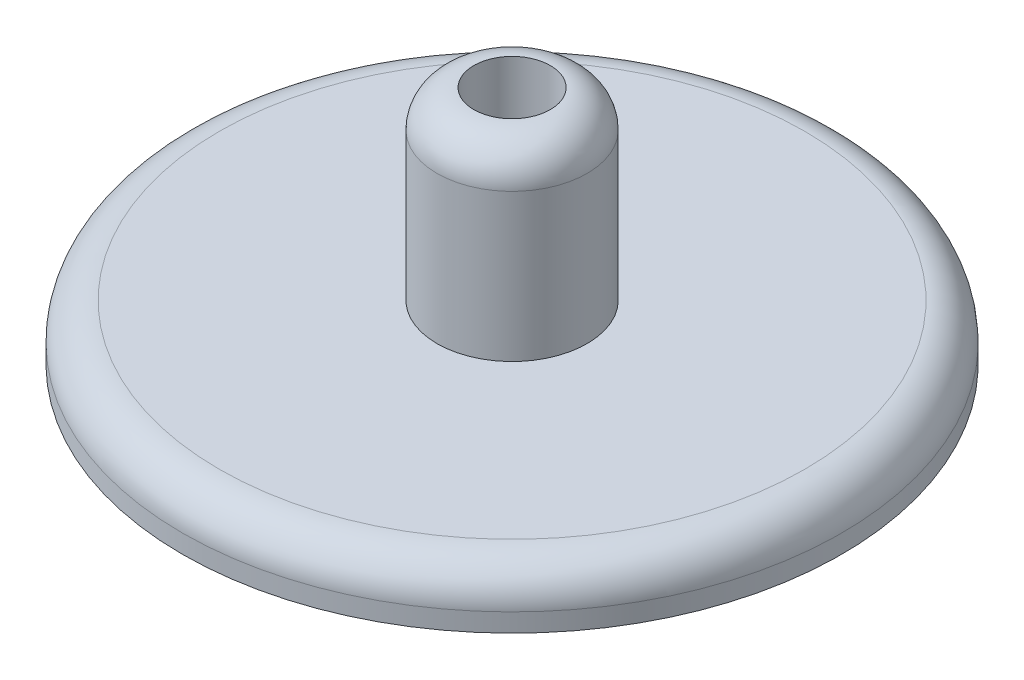
from build123d import *

# Parameters (mm, degrees)
SKETCH1_R           = 17.89
SKETCH1_R_2         = 4.075
SKETCH1_R_3         = 2.075
BOSS_EXTRUDE1_DEPTH = 3
BOSS_EXTRUDE2_START = 3
SKETCH1_4_R         = 4.075
SKETCH1_4_R_2       = 2.075
BOSS_EXTRUDE2_DEPTH = 5
BOSS_EXTRUDE3_START = 8
SKETCH1_5_R         = 4.075
SKETCH1_5_R_2       = 2.075
BOSS_EXTRUDE3_DEPTH = 5
FILLET1_R           = 2


with BuildPart() as part:
    # Sketch1 → Boss-Extrude1 (new body)
    # profile 1 of 3: a face of its own
    with BuildSketch(Plane(origin=(0, 0, 0), x_dir=(1, 0, 0), z_dir=(0, 1, 0))):
        with Locations(Location((-18.178896686, 33.907594253, 0), (0, 0, 270))):
            Circle(SKETCH1_R)
        with Locations((-18.178896686, 33.907594253)):
            Circle(SKETCH1_R_2, mode=Mode.SUBTRACT)
    # profile 2 of 3: a face of its own
    with BuildSketch(Plane(origin=(0, 0, 0), x_dir=(1, 0, 0), z_dir=(0, 1, 0))):
        with Locations((-18.178896686, 33.907594253)):
            Circle(SKETCH1_R_2)
        with Locations((-18.178896686, 33.907594253)):
            Circle(SKETCH1_R_3, mode=Mode.SUBTRACT)
    # profile 3 of 3: a face of its own
    with BuildSketch(Plane(origin=(0, 0, 0), x_dir=(1, 0, 0), z_dir=(0, 1, 0))):
        with Locations((-18.178896686, 33.907594253)):
            Circle(SKETCH1_R_3)
    extrude(amount=BOSS_EXTRUDE1_DEPTH)

    # Sketch1<4> → Boss-Extrude2 (add)
    # profile 1 of 2: a face of its own
    with BuildSketch(Plane(origin=(0, 0, 0), x_dir=(1, 0, 0), z_dir=(0, 1, 0)).offset(BOSS_EXTRUDE2_START)):
        with Locations(Location((-18.178896686, 33.907594253, 0), (0, 0, 270))):
            Circle(SKETCH1_4_R)
        with Locations((-18.178896686, 33.907594253)):
            Circle(SKETCH1_4_R_2, mode=Mode.SUBTRACT)
    # profile 2 of 2: a face of its own
    with BuildSketch(Plane(origin=(0, 0, 0), x_dir=(1, 0, 0), z_dir=(0, 1, 0)).offset(BOSS_EXTRUDE2_START)):
        with Locations((-18.178896686, 33.907594253)):
            Circle(SKETCH1_4_R_2)
    extrude(amount=BOSS_EXTRUDE2_DEPTH)

    # Sketch1<5> → Boss-Extrude3 (add)
    with BuildSketch(Plane(origin=(0, 0, 0), x_dir=(1, 0, 0), z_dir=(0, 1, 0)).offset(BOSS_EXTRUDE3_START)):
        with Locations(Location((-18.178896686, 33.907594253, 0), (0, 0, 270))):
            Circle(SKETCH1_5_R)
        with Locations(Location((-18.178896686, 33.907594253, 0), (0, 0, 270))):
            Circle(SKETCH1_5_R_2, mode=Mode.SUBTRACT)
    extrude(amount=BOSS_EXTRUDE3_DEPTH)

    # Fillet1
    fillet1_edges = [part.edges().sort_by_distance(p)[0] for p in [
        (-18.178896686, 13, -37.982594253),
        (-18.178896686, 3, -51.797594253),
    ]]
    fillet(fillet1_edges, radius=FILLET1_R - 0.0001)  # a hair under: the kernel refuses the full size


solid = part.part
